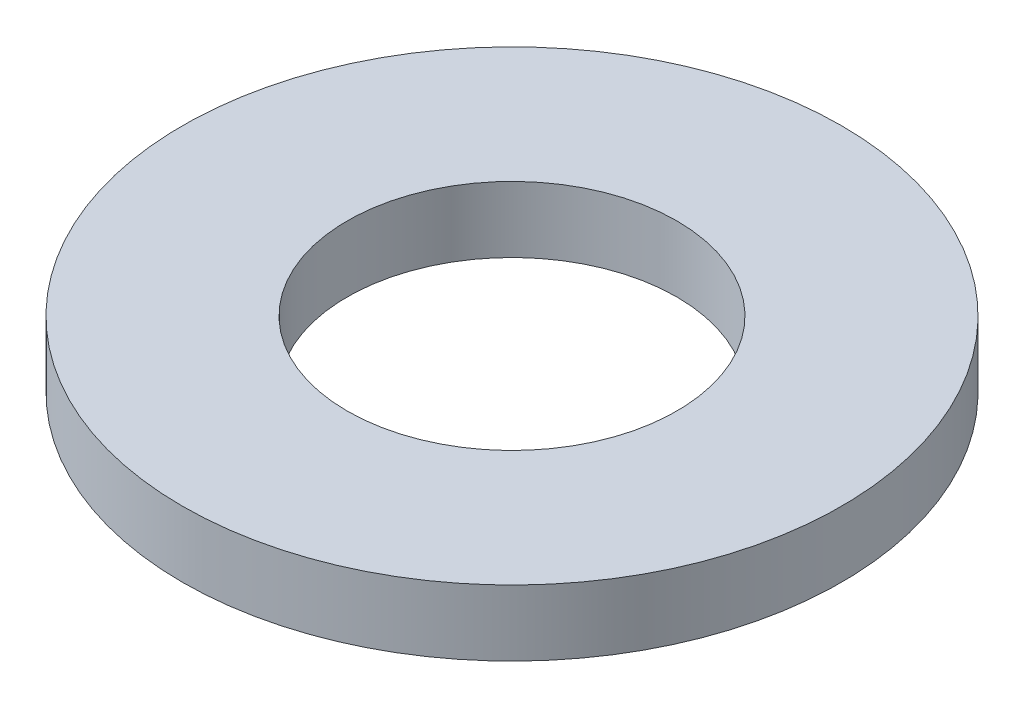
from build123d import *

# Parameters (mm, degrees)
SKETCH1_R           = 75
BOSS_EXTRUDE1_DEPTH = 15
SKETCH2_R           = 37.5
CUT_EXTRUDE1_DEPTH  = 108.121426428


with BuildPart() as part:
    # Sketch1 → Boss-Extrude1 (new body)
    with BuildSketch(Plane(origin=(0, 0, 0), x_dir=(1, 0, 0), z_dir=(0, 1, 0))):
        Circle(SKETCH1_R)
    extrude(amount=BOSS_EXTRUDE1_DEPTH)

    # Sketch2 → Cut-Extrude1 (cut, through all)
    with BuildSketch(Plane(origin=(0, 0, 0), x_dir=(1, 0, 0), z_dir=(0, 1, 0))):
        Circle(SKETCH2_R)
    extrude(amount=CUT_EXTRUDE1_DEPTH, mode=Mode.SUBTRACT)


solid = part.part
